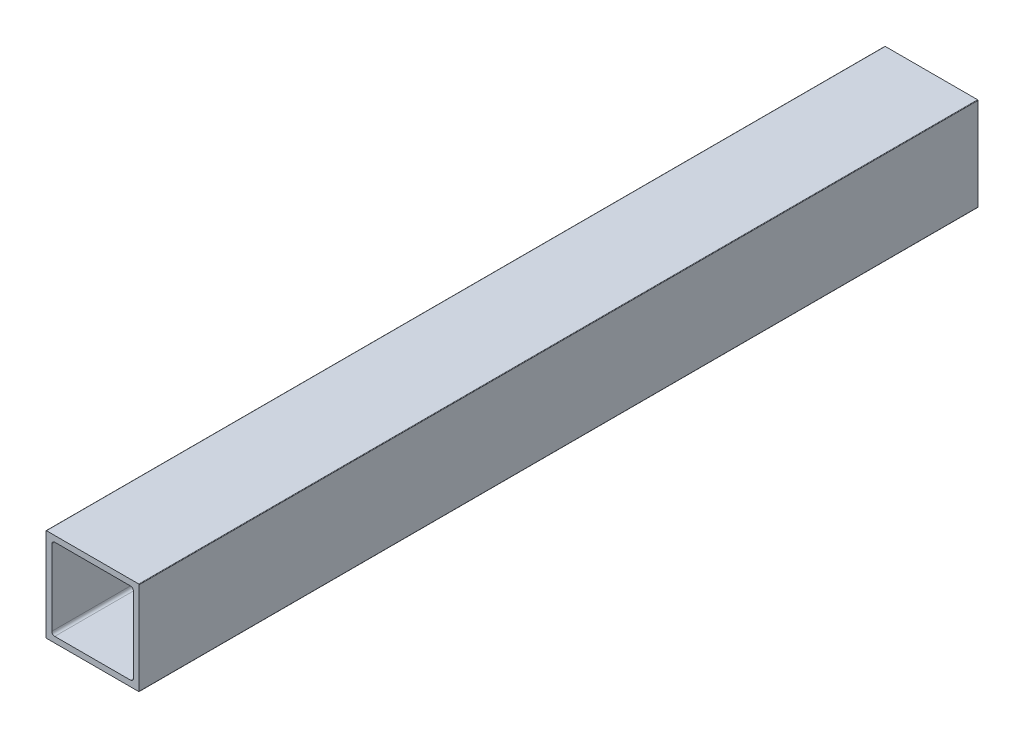
from build123d import *

# Parameters (mm, degrees)
BOSS_EXTRUDE1_DEPTH = 457.2


with BuildPart() as part:
    # Sketch1 → Boss-Extrude1 (new body)
    with BuildSketch(Plane(origin=(0, 0, 0), x_dir=(-1, 0, 0), z_dir=(0, 0, -1))):
        with BuildLine():
            Line((25.4, 0.254), (25.4, 50.546))
            ThreePointArc((25.4, 50.546), (25.325605122, 50.725605122), (25.146, 50.8))
            Line((25.146, 50.8), (-25.146, 50.8))
            ThreePointArc((-25.146, 50.8), (-25.325605122, 50.725605122), (-25.4, 50.546))
            Line((-25.4, 50.546), (-25.4, 0.254))
            ThreePointArc((-25.4, 0.254), (-25.325605122, 0.074394878), (-25.146, 0))
            Line((-25.146, 0), (25.146, 0))
            ThreePointArc((25.146, 0), (25.325605122, 0.074394878), (25.4, 0.254))
        make_face()
        with BuildLine():
            Line((22.225, 46.0375), (22.225, 4.7625))
            ThreePointArc((22.225, 4.7625), (21.760032015, 3.639967985), (20.6375, 3.175))
            Line((20.6375, 3.175), (-20.6375, 3.175))
            ThreePointArc((-20.6375, 3.175), (-21.760032015, 3.639967985), (-22.225, 4.7625))
            Line((-22.225, 4.7625), (-22.225, 46.0375))
            ThreePointArc((-22.225, 46.0375), (-21.760032015, 47.160032015), (-20.6375, 47.625))
            Line((-20.6375, 47.625), (20.6375, 47.625))
            ThreePointArc((20.6375, 47.625), (21.760032015, 47.160032015), (22.225, 46.0375))
        make_face(mode=Mode.SUBTRACT)
    extrude(amount=-BOSS_EXTRUDE1_DEPTH)


solid = part.part
